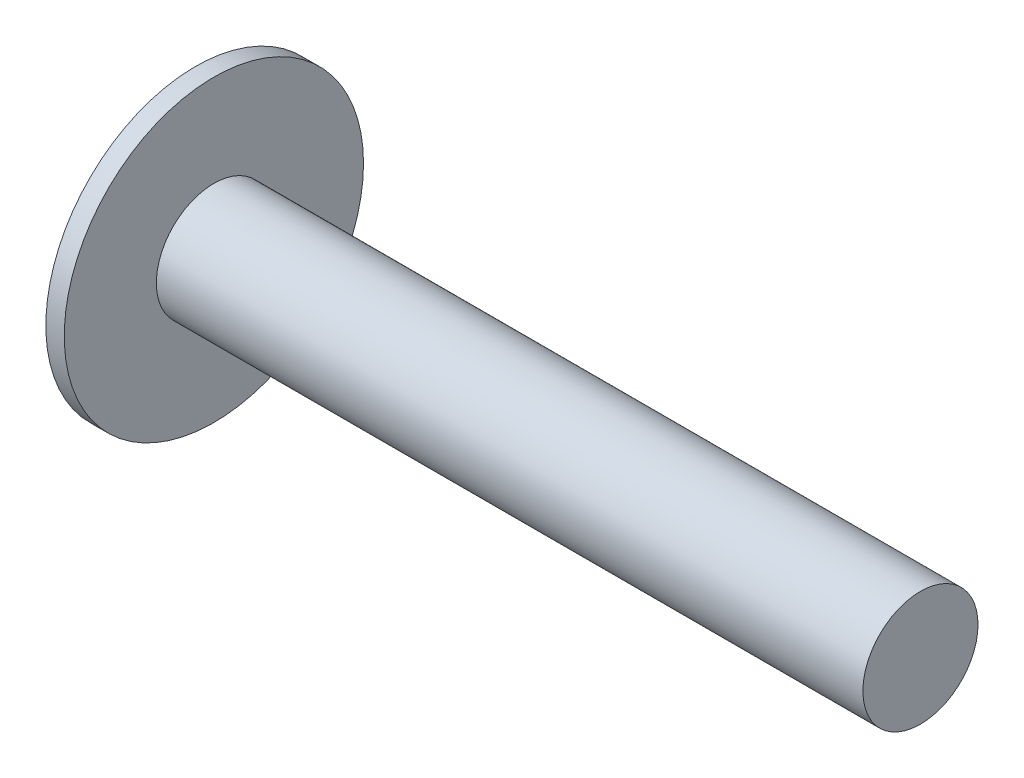
from build123d import *

# Parameters (mm, degrees)
SKETCH2_W          = 3.374008709
SKETCH2_H          = 0.730872065
CUT_EXTRUDE1_DEPTH = 0.254


with BuildPart() as part:
    # Sketch1 → Revolve1 (revolve)
    with BuildSketch(Plane(origin=(0, 0, 0), x_dir=(1, 0, 0), z_dir=(0, 1, 0))):
        Polygon((0, 0), (-19.490008539, 0), (-19.490008539, -2.54), (-19.998008539, -2.54), (-19.998008539, 1.5875), (-19.490008539, 1.5875), (0, 1.5875), align=None)
    revolve(axis=Axis((0, 0, -1.5875), (-1, 0, 0)))

    # Sketch2 → Cut-Extrude1 (cut)
    with BuildSketch(Plane.ZY.offset(19.998008539)):
        with Locations((-1.687004355, -0.012747769)):
            Rectangle(SKETCH2_W, SKETCH2_H)
    extrude(amount=-CUT_EXTRUDE1_DEPTH, mode=Mode.SUBTRACT)


solid = part.part
